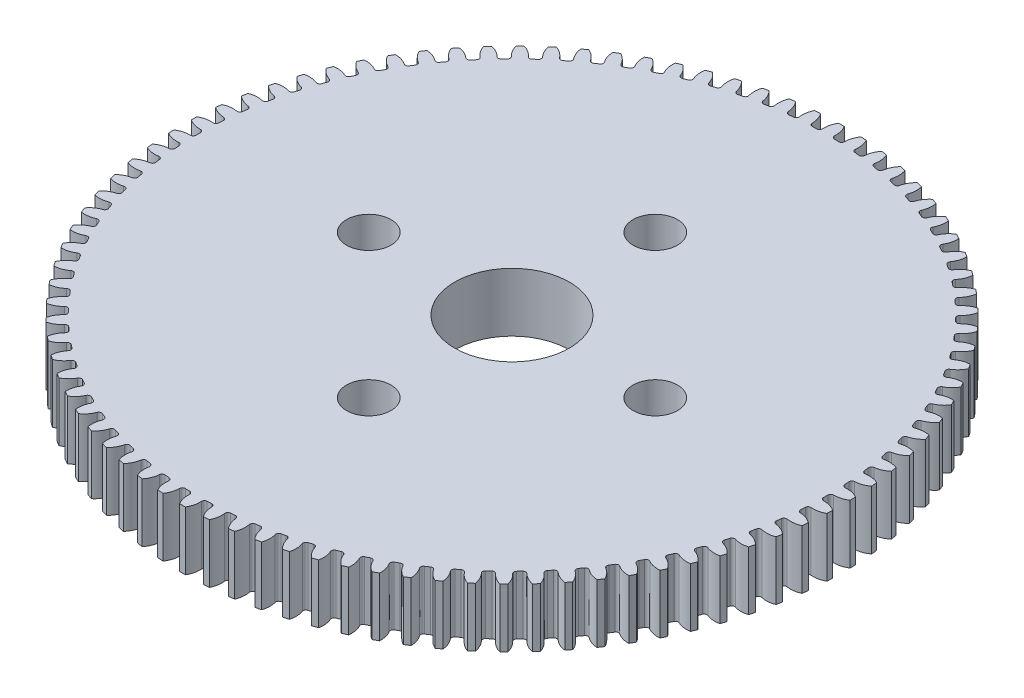
from build123d import *

# Parameters (mm, degrees)
SKETCH1_R           = 1.55
SKETCH1_R_2         = 4
BOSS_EXTRUDE1_DEPTH = 4.1


with BuildPart() as part:
    # Sketch1 → Boss-Extrude1 (new body)
    with BuildSketch(Plane(origin=(0, 0, 0), x_dir=(1, 0, 0), z_dir=(0, 1, 0))):
        with BuildLine():
            Line((0.1965, 23), (-0.1965, 23))
            ThreePointArc((-0.1965, 23), (-0.377010574, 22.569135791), (-0.41916526, 22.103892825))
            ThreePointArc((-0.41916526, 22.103892825), (-0.471074822, 21.956480692), (-0.613170946, 21.891414331))
            ThreePointArc((-0.613170946, 21.891414331), (-0.764298978, 21.886659112), (-0.915390576, 21.880860588))
            ThreePointArc((-0.915390576, 21.880860588), (-1.061679361, 21.935856327), (-1.123745425, 22.079288344))
            ThreePointArc((-1.123745425, 22.079288344), (-1.198251133, 22.540457438), (-1.40837756, 22.957680303))
            Line((-1.40837756, 22.957680303), (-1.800420232, 22.930266009))
            ThreePointArc((-1.800420232, 22.930266009), (-1.950435523, 22.487859582), (-1.960033814, 22.020809363))
            ThreePointArc((-1.960033814, 22.020809363), (-2.001533977, 21.87013529), (-2.138745162, 21.795315302))
            ThreePointArc((-2.138745162, 21.795315302), (-2.289173346, 21.780029509), (-2.439492408, 21.763705493))
            ThreePointArc((-2.439492408, 21.763705493), (-2.58926115, 21.808362675), (-2.661181336, 21.947115789))
            ThreePointArc((-2.661181336, 21.947115789), (-2.767675081, 22.401964243), (-3.006393647, 22.803513095))
            Line((-3.006393647, 22.803513095), (-3.395568998, 22.748818067))
            ThreePointArc((-3.395568998, 22.748818067), (-3.514358147, 22.297024782), (-3.49135328, 21.830442731))
            ThreePointArc((-3.49135328, 21.830442731), (-3.522241858, 21.677240787), (-3.653899626, 21.593031689))
            ThreePointArc((-3.653899626, 21.593031689), (-3.802895091, 21.567289791), (-3.951709278, 21.540519812))
            ThreePointArc((-3.951709278, 21.540519812), (-4.104228318, 21.574620872), (-4.185652238, 21.708019092))
            ThreePointArc((-4.185652238, 21.708019092), (-4.323615194, 22.15433093), (-4.589762885, 22.538249464))
            Line((-4.589762885, 22.538249464), (-4.974174892, 22.45654017))
            ThreePointArc((-4.974174892, 22.45654017), (-5.061159171, 21.997561118), (-5.005663224, 21.533720376))
            ThreePointArc((-5.005663224, 21.533720376), (-5.025789732, 21.378736946), (-5.151252658, 21.285548996))
            ThreePointArc((-5.151252658, 21.285548996), (-5.298089514, 21.249476405), (-5.444673817, 21.212390884))
            ThreePointArc((-5.444673817, 21.212390884), (-5.599200098, 21.235769685), (-5.689731063, 21.363163108))
            ThreePointArc((-5.689731063, 21.363163108), (-5.858491089, 21.798763944), (-6.150771261, 22.163181747))
            Line((-6.150771261, 22.163181747), (-6.528547107, 22.054856266))
            ThreePointArc((-6.528547107, 22.054856266), (-6.583302736, 21.590927548), (-6.49558608, 21.1320879))
            ThreePointArc((-6.49558608, 21.1320879), (-6.504852463, 20.976078048), (-6.623509305, 20.874365248))
            ThreePointArc((-6.623509305, 20.874365248), (-6.767472177, 20.828137707), (-6.911112453, 20.78091732))
            ThreePointArc((-6.911112453, 20.78091732), (-7.066893139, 20.793459963), (-7.166090091, 20.914227941))
            ThreePointArc((-7.166090091, 20.914227941), (-7.364825004, 21.33699557), (-7.681813697, 21.680137236))
            Line((-7.681813697, 21.680137236), (-8.051112896, 21.54572332))
            ThreePointArc((-8.051112896, 21.54572332), (-8.073373112, 21.079105149), (-7.953863094, 20.627502016))
            ThreePointArc((-7.953863094, 20.627502016), (-7.952224207, 20.471225806), (-8.06349688, 20.36148369))
            ThreePointArc((-8.06349688, 20.36148369), (-8.203884396, 20.305326415), (-8.343880844, 20.248201215))
            ThreePointArc((-8.343880844, 20.248201215), (-8.500156986, 20.249846594), (-8.607536648, 20.363400758))
            ThreePointArc((-8.607536648, 20.363400758), (-8.835278231, 20.7712755), (-9.175431108, 21.091469276))
            Line((-9.175431108, 21.091469276), (-9.534454473, 20.931621775))
            ThreePointArc((-9.534454473, 20.931621775), (-9.524110826, 20.464587469), (-9.373389686, 20.022421016))
            ThreePointArc((-9.373389686, 20.022421016), (-9.360853514, 19.86663981), (-9.46419991, 19.749403031))
            ThreePointArc((-9.46419991, 19.749403031), (-9.600328115, 19.683589614), (-9.735998686, 19.61683791))
            ThreePointArc((-9.735998686, 19.61683791), (-9.892008923, 19.607578007), (-10.007048151, 19.713365133))
            ThreePointArc((-10.007048151, 19.713365133), (-10.262686872, 20.104359862), (-10.624346742, 20.400045798))
            Line((-10.624346742, 20.400045798), (-10.971345146, 20.215543474))
            ThreePointArc((-10.971345146, 20.215543474), (-10.928448029, 19.750368376), (-10.747250066, 19.319792793))
            ThreePointArc((-10.747250066, 19.319792793), (-10.723877684, 19.165265541), (-10.818794308, 19.041105265))
            ThreePointArc((-10.818794308, 19.041105265), (-10.95, 18.965956343), (-11.080683721, 18.889903342))
            ThreePointArc((-11.080683721, 18.889903342), (-11.235667987, 18.869783272), (-11.357806322, 18.967287974))
            ThreePointArc((-11.357806322, 18.967287974), (-11.640096733, 19.339497805), (-12.021501626, 19.609235347))
            Line((-12.021501626, 19.609235347), (-12.354784528, 19.400977076))
            ThreePointArc((-12.354784528, 19.400977076), (-12.279542932, 18.939927473), (-12.068750923, 18.523040482))
            ThreePointArc((-12.068750923, 18.523040482), (-12.034656199, 18.370520026), (-12.120680629, 18.240041148))
            ThreePointArc((-12.120680629, 18.240041148), (-12.246324586, 18.155922839), (-12.371384779, 18.070939064))
            ThreePointArc((-12.371384779, 18.070939064), (-12.524588006, 18.040056849), (-12.653230402, 18.128804096))
            ThreePointArc((-12.653230402, 18.128804096), (-12.960797213, 18.480415658), (-13.360088963, 18.722890673))
            Line((-13.360088963, 18.722890673), (-13.678032642, 18.491891069))
            ThreePointArc((-13.678032642, 18.491891069), (-13.570813136, 18.037213148), (-13.33145404, 17.63604578))
            ThreePointArc((-13.33145404, 17.63604578), (-13.28680308, 17.486275183), (-13.363516211, 17.350113385))
            ThreePointArc((-13.363516211, 17.350113385), (-13.48298631, 17.257435504), (-13.601813694, 17.163934987))
            ThreePointArc((-13.601813694, 17.163934987), (-13.752489491, 17.122441083), (-13.887009216, 17.201998506))
            ThreePointArc((-13.887009216, 17.201998506), (-14.218353993, 17.531298784), (-14.63358729, 17.745329957))
            Line((-14.63358729, 17.745329957), (-14.934642756, 17.492714426))
            ThreePointArc((-14.934642756, 17.492714426), (-14.795967703, 17.046623333), (-14.529207652, 16.663130035))
            ThreePointArc((-14.529207652, 16.663130035), (-14.474217991, 16.516838965), (-14.541246086, 16.375657613))
            ThreePointArc((-14.541246086, 16.375657613), (-14.653960279, 16.274871678), (-14.76597594, 16.173309944))
            ThreePointArc((-14.76597594, 16.173309944), (-14.91339023, 16.121406505), (-15.053131917, 16.191386508))
            ThreePointArc((-15.053131917, 16.191386508), (-15.40664038, 16.496771184), (-15.83579225, 16.681315778))
            Line((-15.83579225, 16.681315778), (-16.118492791, 16.408315038))
            ThreePointArc((-16.118492791, 16.408315038), (-15.949037802, 15.972984083), (-15.656176425, 15.609033195))
            ThreePointArc((-15.656176425, 15.609033195), (-15.591115967, 15.466934369), (-15.648132472, 15.321421283))
            ThreePointArc((-15.648132472, 15.321421283), (-15.753541627, 15.213018313), (-15.858199835, 15.103890161))
            ThreePointArc((-15.858199835, 15.103890161), (-16.00163443, 15.041830055), (-16.145917272, 15.101891703))
            ThreePointArc((-16.145917272, 15.101891703), (-16.519867164, 15.381872974), (-16.960846822, 15.536031904))
            Line((-16.960846822, 15.536031904), (-17.22381515, 15.243975988))
            ThreePointArc((-17.22381515, 15.243975988), (-17.024405792, 14.82152606), (-16.706869881, 14.478890715))
            ThreePointArc((-16.706869881, 14.478890715), (-16.632055593, 14.341676422), (-16.678782729, 14.192540529))
            ThreePointArc((-16.678782729, 14.192540529), (-16.776373304, 14.077048652), (-16.873164175, 13.960885743))
            ThreePointArc((-16.873164175, 13.960885743), (-17.011920276, 13.888971321), (-17.160041341, 13.938822))
            ThreePointArc((-17.160041341, 13.938822), (-17.552610817, 14.192035824), (-18.003269853, 14.315058046))
            Line((-18.003269853, 14.315058046), (-18.245224813, 14.005369819))
            ThreePointArc((-18.245224813, 14.005369819), (-18.016832589, 13.597859051), (-17.676169145, 13.278208535))
            ThreePointArc((-17.676169145, 13.278208535), (-17.591965516, 13.14654727), (-17.628175634, 12.994515144))
            ThreePointArc((-17.628175634, 12.994515144), (-17.717472177, 12.872497025), (-17.805924155, 12.749865293))
            ThreePointArc((-17.805924155, 12.749865293), (-17.939325757, 12.668446915), (-18.090563413, 12.707843757))
            ThreePointArc((-18.090563413, 12.707843757), (-18.499839913, 12.933056502), (-18.957982763, 13.024342663))
            Line((-18.957982763, 13.024342663), (-19.177745574, 12.698530897))
            ThreePointArc((-19.177745574, 12.698530897), (-18.921483188, 12.307944641), (-18.559351891, 12.012836258))
            ThreePointArc((-18.559351891, 12.012836258), (-18.466169152, 11.887369461), (-18.491685838, 11.733181788))
            ThreePointArc((-18.491685838, 11.733181788), (-18.572253306, 11.605231887), (-18.651935462, 11.476728782))
            ThreePointArc((-18.651935462, 11.476728782), (-18.779332646, 11.386203109), (-18.932950079, 11.414954176))
            ThreePointArc((-18.932950079, 11.414954176), (-19.356939649, 11.61106863), (-19.820334287, 11.670173992))
            Line((-19.820334287, 11.670173992), (-20.016834287, 11.329826008))
            ThreePointArc((-20.016834287, 11.329826008), (-19.733950223, 10.958067161), (-19.352115339, 10.688938649))
            ThreePointArc((-19.352115339, 10.688938649), (-19.250407468, 10.570277583), (-19.265106408, 10.414685549))
            ThreePointArc((-19.265106408, 10.414685549), (-19.336552284, 10.281427225), (-19.407076414, 10.147678801))
            ThreePointArc((-19.407076414, 10.147678801), (-19.527848513, 10.048486866), (-19.683097316, 10.066452086))
            ThreePointArc((-19.683097316, 10.066452086), (-20.119734321, 10.232512798), (-20.586123135, 10.259149406))
            Line((-20.586123135, 10.259149406), (-20.758402995, 9.905923346))
            ThreePointArc((-20.758402995, 9.905923346), (-20.450275436, 9.554803079), (-20.050597227, 9.312965607))
            ThreePointArc((-20.050597227, 9.312965607), (-19.940859733, 9.201688375), (-19.944669316, 9.045450009))
            ThreePointArc((-19.944669316, 9.045450009), (-20.006645522, 8.907532483), (-20.067668042, 8.769190349))
            ThreePointArc((-20.067668042, 8.769190349), (-20.181226666, 8.661815405), (-20.337350481, 8.668907254))
            ThreePointArc((-20.337350481, 8.668907254), (-20.78450767, 8.804105192), (-21.251618459, 8.798143276))
            Line((-21.251618459, 8.798143276), (-21.398838851, 8.433760021))
            ThreePointArc((-21.398838851, 8.433760021), (-21.066968963, 8.104988958), (-20.651394621, 7.891620731))
            ThreePointArc((-20.651394621, 7.891620731), (-20.534162135, 7.788269466), (-20.5270638, 7.632145946))
            ThreePointArc((-20.5270638, 7.632145946), (-20.579268395, 7.490241139), (-20.630492007, 7.347979283))
            ThreePointArc((-20.630492007, 7.347979283), (-20.736283911, 7.23294445), (-20.892522118, 7.229128377))
            ThreePointArc((-20.892522118, 7.229128377), (-21.348020986, 7.332804871), (-21.813578035, 7.294273476))
            Line((-21.813578035, 7.294273476), (-21.935021714, 6.920508265))
            ThreePointArc((-21.935021714, 6.920508265), (-21.581026335, 6.615688145), (-21.151580496, 6.431828673))
            ThreePointArc((-21.151580496, 6.431828673), (-21.027424162, 6.336906891), (-21.009452493, 6.181658835))
            ThreePointArc((-21.009452493, 6.181658835), (-21.051631141, 6.036458092), (-21.092806289, 5.890969601))
            ThreePointArc((-21.092806289, 5.890969601), (-21.190316065, 5.768835316), (-21.345907488, 5.754129913))
            ThreePointArc((-21.345907488, 5.754129913), (-21.807528891, 5.825779861), (-22.269264052, 5.754866709))
            Line((-22.269264052, 5.754866709), (-22.364339357, 5.373540489))
            ThreePointArc((-22.364339357, 5.373540489), (-21.989943116, 5.094156364), (-21.548717997, 4.940701392))
            ThreePointArc((-21.548717997, 4.940701392), (-21.418242693, 4.854671543), (-21.389485245, 4.701055303))
            ThreePointArc((-21.389485245, 4.701055303), (-21.421432456, 4.553266029), (-21.45235854, 4.405259707))
            ThreePointArc((-21.45235854, 4.405259707), (-21.54111113, 4.276620997), (-21.695297743, 4.251097906))
            ThreePointArc((-21.695297743, 4.251097906), (-22.160792706, 4.290372238), (-22.616456452, 4.18742281))
            Line((-22.616456452, 4.18742281), (-22.684700186, 3.800393363))
            ThreePointArc((-22.684700186, 3.800393363), (-22.291727104, 3.547806366), (-21.84087231, 3.425503511))
            ThreePointArc((-21.84087231, 3.425503511), (-21.704713698, 3.348784723), (-21.665310575, 3.197548703))
            ThreePointArc((-21.665310575, 3.197548703), (-21.686870705, 3.047890911), (-21.707397056, 2.89808783))
            ThreePointArc((-21.707397056, 2.89808783), (-21.786960066, 2.763571411), (-21.938990687, 2.727354978))
            ThreePointArc((-21.938990687, 2.727354978), (-22.406091367, 2.734062352), (-22.85346375, 2.599578208))
            Line((-22.85346375, 2.599578208), (-22.894543437, 2.208731103))
            ThreePointArc((-22.894543437, 2.208731103), (-22.484908039, 1.984171811), (-22.026620088, 1.893616921))
            ThreePointArc((-22.026620088, 1.893616921), (-21.88544152, 1.82658296), (-21.835584689, 1.678463967))
            ThreePointArc((-21.835584689, 1.678463967), (-21.846652701, 1.527666775), (-21.856679315, 1.376796761))
            ThreePointArc((-21.856679315, 1.376796761), (-21.926665123, 1.237057982), (-22.075799075, 1.19032465))
            ThreePointArc((-22.075799075, 1.19032465), (-22.542229804, 1.164432389), (-22.97913127, 0.999068722))
            Line((-22.97913127, 0.999068722), (-22.992846773, 0.606308127))
            ThreePointArc((-22.992846773, 0.606308127), (-22.568544762, 0.410870571), (-22.105056388, 0.352504819))
            ThreePointArc((-22.105056388, 0.352504819), (-21.959545671, 0.295482269), (-21.89947803, 0.151201923))
            ThreePointArc((-21.89947803, 0.151201923), (-21.9, 0), (-21.89947803, -0.151201923))
            ThreePointArc((-21.89947803, -0.151201923), (-21.959545671, -0.295482269), (-22.105056388, -0.352504819))
            ThreePointArc((-22.105056388, -0.352504819), (-22.568544762, -0.410870571), (-22.992846773, -0.606308127))
            Line((-22.992846773, -0.606308127), (-22.97913127, -0.999068722))
            ThreePointArc((-22.97913127, -0.999068722), (-22.542229804, -1.164432389), (-22.075799075, -1.19032465))
            ThreePointArc((-22.075799075, -1.19032465), (-21.926665123, -1.237057982), (-21.856679315, -1.376796761))
            ThreePointArc((-21.856679315, -1.376796761), (-21.846652701, -1.527666775), (-21.835584689, -1.678463967))
            ThreePointArc((-21.835584689, -1.678463967), (-21.88544152, -1.82658296), (-22.026620088, -1.893616921))
            ThreePointArc((-22.026620088, -1.893616921), (-22.484908039, -1.984171811), (-22.894543437, -2.208731103))
            Line((-22.894543437, -2.208731103), (-22.85346375, -2.599578208))
            ThreePointArc((-22.85346375, -2.599578208), (-22.406091367, -2.734062352), (-21.938990687, -2.727354978))
            ThreePointArc((-21.938990687, -2.727354978), (-21.786960066, -2.763571411), (-21.707397056, -2.89808783))
            ThreePointArc((-21.707397056, -2.89808783), (-21.686870705, -3.047890911), (-21.665310575, -3.197548703))
            ThreePointArc((-21.665310575, -3.197548703), (-21.704713698, -3.348784723), (-21.84087231, -3.425503511))
            ThreePointArc((-21.84087231, -3.425503511), (-22.291727104, -3.547806366), (-22.684700186, -3.800393363))
            Line((-22.684700186, -3.800393363), (-22.616456452, -4.18742281))
            ThreePointArc((-22.616456452, -4.18742281), (-22.160792706, -4.290372238), (-21.695297743, -4.251097906))
            ThreePointArc((-21.695297743, -4.251097906), (-21.54111113, -4.276620997), (-21.45235854, -4.405259707))
            ThreePointArc((-21.45235854, -4.405259707), (-21.421432456, -4.553266029), (-21.389485245, -4.701055303))
            ThreePointArc((-21.389485245, -4.701055303), (-21.418242693, -4.854671543), (-21.548717997, -4.940701392))
            ThreePointArc((-21.548717997, -4.940701392), (-21.989943116, -5.094156364), (-22.364339357, -5.373540489))
            Line((-22.364339357, -5.373540489), (-22.269264052, -5.754866709))
            ThreePointArc((-22.269264052, -5.754866709), (-21.807528891, -5.825779861), (-21.345907488, -5.754129913))
            ThreePointArc((-21.345907488, -5.754129913), (-21.190316065, -5.768835316), (-21.092806289, -5.890969601))
            ThreePointArc((-21.092806289, -5.890969601), (-21.051631141, -6.036458092), (-21.009452493, -6.181658835))
            ThreePointArc((-21.009452493, -6.181658835), (-21.027424162, -6.336906891), (-21.151580496, -6.431828673))
            ThreePointArc((-21.151580496, -6.431828673), (-21.581026335, -6.615688145), (-21.935021714, -6.920508265))
            Line((-21.935021714, -6.920508265), (-21.813578035, -7.294273476))
            ThreePointArc((-21.813578035, -7.294273476), (-21.348020986, -7.332804871), (-20.892522118, -7.229128377))
            ThreePointArc((-20.892522118, -7.229128377), (-20.736283911, -7.23294445), (-20.630492007, -7.347979283))
            ThreePointArc((-20.630492007, -7.347979283), (-20.579268395, -7.490241139), (-20.5270638, -7.632145946))
            ThreePointArc((-20.5270638, -7.632145946), (-20.534162135, -7.788269466), (-20.651394621, -7.891620731))
            ThreePointArc((-20.651394621, -7.891620731), (-21.066968963, -8.104988958), (-21.398838851, -8.433760021))
            Line((-21.398838851, -8.433760021), (-21.251618459, -8.798143276))
            ThreePointArc((-21.251618459, -8.798143276), (-20.78450767, -8.804105192), (-20.337350481, -8.668907254))
            ThreePointArc((-20.337350481, -8.668907254), (-20.181226666, -8.661815405), (-20.067668042, -8.769190349))
            ThreePointArc((-20.067668042, -8.769190349), (-20.006645522, -8.907532483), (-19.944669316, -9.045450009))
            ThreePointArc((-19.944669316, -9.045450009), (-19.940859733, -9.201688375), (-20.050597227, -9.312965607))
            ThreePointArc((-20.050597227, -9.312965607), (-20.450275436, -9.554803079), (-20.758402995, -9.905923346))
            Line((-20.758402995, -9.905923346), (-20.586123135, -10.259149406))
            ThreePointArc((-20.586123135, -10.259149406), (-20.119734321, -10.232512798), (-19.683097316, -10.066452086))
            ThreePointArc((-19.683097316, -10.066452086), (-19.527848513, -10.048486866), (-19.407076414, -10.147678801))
            ThreePointArc((-19.407076414, -10.147678801), (-19.336552284, -10.281427225), (-19.265106408, -10.414685549))
            ThreePointArc((-19.265106408, -10.414685549), (-19.250407468, -10.570277583), (-19.352115339, -10.688938649))
            ThreePointArc((-19.352115339, -10.688938649), (-19.733950223, -10.958067161), (-20.016834287, -11.329826008))
            Line((-20.016834287, -11.329826008), (-19.820334287, -11.670173992))
            ThreePointArc((-19.820334287, -11.670173992), (-19.356939649, -11.61106863), (-18.932950079, -11.414954176))
            ThreePointArc((-18.932950079, -11.414954176), (-18.779332646, -11.386203109), (-18.651935462, -11.476728782))
            ThreePointArc((-18.651935462, -11.476728782), (-18.572253306, -11.605231887), (-18.491685838, -11.733181788))
            ThreePointArc((-18.491685838, -11.733181788), (-18.466169152, -11.887369461), (-18.559351891, -12.012836258))
            ThreePointArc((-18.559351891, -12.012836258), (-18.921483188, -12.307944641), (-19.177745574, -12.698530897))
            Line((-19.177745574, -12.698530897), (-18.957982763, -13.024342663))
            ThreePointArc((-18.957982763, -13.024342663), (-18.499839913, -12.933056502), (-18.090563413, -12.707843757))
            ThreePointArc((-18.090563413, -12.707843757), (-17.939325757, -12.668446915), (-17.805924155, -12.749865293))
            ThreePointArc((-17.805924155, -12.749865293), (-17.717472177, -12.872497025), (-17.628175634, -12.994515144))
            ThreePointArc((-17.628175634, -12.994515144), (-17.591965516, -13.14654727), (-17.676169145, -13.278208535))
            ThreePointArc((-17.676169145, -13.278208535), (-18.016832589, -13.597859051), (-18.245224813, -14.005369819))
            Line((-18.245224813, -14.005369819), (-18.003269853, -14.315058046))
            ThreePointArc((-18.003269853, -14.315058046), (-17.552610817, -14.192035824), (-17.160041341, -13.938822))
            ThreePointArc((-17.160041341, -13.938822), (-17.011920276, -13.888971321), (-16.873164175, -13.960885743))
            ThreePointArc((-16.873164175, -13.960885743), (-16.776373304, -14.077048652), (-16.678782729, -14.192540529))
            ThreePointArc((-16.678782729, -14.192540529), (-16.632055593, -14.341676422), (-16.706869881, -14.478890715))
            ThreePointArc((-16.706869881, -14.478890715), (-17.024405792, -14.82152606), (-17.22381515, -15.243975988))
            Line((-17.22381515, -15.243975988), (-16.960846822, -15.536031904))
            ThreePointArc((-16.960846822, -15.536031904), (-16.519867164, -15.381872974), (-16.145917272, -15.101891703))
            ThreePointArc((-16.145917272, -15.101891703), (-16.00163443, -15.041830055), (-15.858199835, -15.103890161))
            ThreePointArc((-15.858199835, -15.103890161), (-15.753541627, -15.213018313), (-15.648132472, -15.321421283))
            ThreePointArc((-15.648132472, -15.321421283), (-15.591115967, -15.466934369), (-15.656176425, -15.609033195))
            ThreePointArc((-15.656176425, -15.609033195), (-15.949037802, -15.972984083), (-16.118492791, -16.408315038))
            Line((-16.118492791, -16.408315038), (-15.83579225, -16.681315778))
            ThreePointArc((-15.83579225, -16.681315778), (-15.40664038, -16.496771184), (-15.053131917, -16.191386508))
            ThreePointArc((-15.053131917, -16.191386508), (-14.91339023, -16.121406505), (-14.76597594, -16.173309944))
            ThreePointArc((-14.76597594, -16.173309944), (-14.653960279, -16.274871678), (-14.541246086, -16.375657613))
            ThreePointArc((-14.541246086, -16.375657613), (-14.474217991, -16.516838965), (-14.529207652, -16.663130035))
            ThreePointArc((-14.529207652, -16.663130035), (-14.795967703, -17.046623333), (-14.934642756, -17.492714426))
            Line((-14.934642756, -17.492714426), (-14.63358729, -17.745329957))
            ThreePointArc((-14.63358729, -17.745329957), (-14.218353993, -17.531298784), (-13.887009216, -17.201998506))
            ThreePointArc((-13.887009216, -17.201998506), (-13.752489491, -17.122441083), (-13.601813694, -17.163934987))
            ThreePointArc((-13.601813694, -17.163934987), (-13.48298631, -17.257435504), (-13.363516211, -17.350113385))
            ThreePointArc((-13.363516211, -17.350113385), (-13.28680308, -17.486275183), (-13.33145404, -17.63604578))
            ThreePointArc((-13.33145404, -17.63604578), (-13.570813136, -18.037213148), (-13.678032642, -18.491891069))
            Line((-13.678032642, -18.491891069), (-13.360088963, -18.722890673))
            ThreePointArc((-13.360088963, -18.722890673), (-12.960797213, -18.480415658), (-12.653230402, -18.128804096))
            ThreePointArc((-12.653230402, -18.128804096), (-12.524588006, -18.040056849), (-12.371384779, -18.070939064))
            ThreePointArc((-12.371384779, -18.070939064), (-12.246324586, -18.155922839), (-12.120680629, -18.240041148))
            ThreePointArc((-12.120680629, -18.240041148), (-12.034656199, -18.370520026), (-12.068750923, -18.523040482))
            ThreePointArc((-12.068750923, -18.523040482), (-12.279542932, -18.939927473), (-12.354784528, -19.400977076))
            Line((-12.354784528, -19.400977076), (-12.021501626, -19.609235347))
            ThreePointArc((-12.021501626, -19.609235347), (-11.640096733, -19.339497805), (-11.357806322, -18.967287974))
            ThreePointArc((-11.357806322, -18.967287974), (-11.235667987, -18.869783272), (-11.080683721, -18.889903342))
            ThreePointArc((-11.080683721, -18.889903342), (-10.95, -18.965956343), (-10.818794308, -19.041105265))
            ThreePointArc((-10.818794308, -19.041105265), (-10.723877684, -19.165265541), (-10.747250066, -19.319792793))
            ThreePointArc((-10.747250066, -19.319792793), (-10.928448029, -19.750368376), (-10.971345146, -20.215543474))
            Line((-10.971345146, -20.215543474), (-10.624346742, -20.400045798))
            ThreePointArc((-10.624346742, -20.400045798), (-10.262686872, -20.104359862), (-10.007048151, -19.713365133))
            ThreePointArc((-10.007048151, -19.713365133), (-9.892008923, -19.607578007), (-9.735998686, -19.61683791))
            ThreePointArc((-9.735998686, -19.61683791), (-9.600328115, -19.683589614), (-9.46419991, -19.749403031))
            ThreePointArc((-9.46419991, -19.749403031), (-9.360853514, -19.86663981), (-9.373389686, -20.022421016))
            ThreePointArc((-9.373389686, -20.022421016), (-9.524110826, -20.464587469), (-9.534454473, -20.931621775))
            Line((-9.534454473, -20.931621775), (-9.175431108, -21.091469276))
            ThreePointArc((-9.175431108, -21.091469276), (-8.835278231, -20.7712755), (-8.607536648, -20.363400758))
            ThreePointArc((-8.607536648, -20.363400758), (-8.500156986, -20.249846594), (-8.343880844, -20.248201215))
            ThreePointArc((-8.343880844, -20.248201215), (-8.203884396, -20.305326415), (-8.06349688, -20.36148369))
            ThreePointArc((-8.06349688, -20.36148369), (-7.952224207, -20.471225806), (-7.953863094, -20.627502016))
            ThreePointArc((-7.953863094, -20.627502016), (-8.073373112, -21.079105149), (-8.051112896, -21.54572332))
            Line((-8.051112896, -21.54572332), (-7.681813697, -21.680137236))
            ThreePointArc((-7.681813697, -21.680137236), (-7.364825004, -21.33699557), (-7.166090091, -20.914227941))
            ThreePointArc((-7.166090091, -20.914227941), (-7.066893139, -20.793459963), (-6.911112453, -20.78091732))
            ThreePointArc((-6.911112453, -20.78091732), (-6.767472177, -20.828137707), (-6.623509305, -20.874365248))
            ThreePointArc((-6.623509305, -20.874365248), (-6.504852463, -20.976078048), (-6.49558608, -21.1320879))
            ThreePointArc((-6.49558608, -21.1320879), (-6.583302736, -21.590927548), (-6.528547107, -22.054856266))
            Line((-6.528547107, -22.054856266), (-6.150771261, -22.163181747))
            ThreePointArc((-6.150771261, -22.163181747), (-5.858491089, -21.798763944), (-5.689731063, -21.363163108))
            ThreePointArc((-5.689731063, -21.363163108), (-5.599200098, -21.235769685), (-5.444673817, -21.212390884))
            ThreePointArc((-5.444673817, -21.212390884), (-5.298089514, -21.249476405), (-5.151252658, -21.285548996))
            ThreePointArc((-5.151252658, -21.285548996), (-5.025789732, -21.378736946), (-5.005663224, -21.533720376))
            ThreePointArc((-5.005663224, -21.533720376), (-5.061159171, -21.997561118), (-4.974174892, -22.45654017))
            Line((-4.974174892, -22.45654017), (-4.589762885, -22.538249464))
            ThreePointArc((-4.589762885, -22.538249464), (-4.323615194, -22.15433093), (-4.185652238, -21.708019092))
            ThreePointArc((-4.185652238, -21.708019092), (-4.104228318, -21.574620872), (-3.951709278, -21.540519812))
            ThreePointArc((-3.951709278, -21.540519812), (-3.802895091, -21.567289791), (-3.653899626, -21.593031689))
            ThreePointArc((-3.653899626, -21.593031689), (-3.522241858, -21.677240787), (-3.49135328, -21.830442731))
            ThreePointArc((-3.49135328, -21.830442731), (-3.514358147, -22.297024782), (-3.395568998, -22.748818067))
            Line((-3.395568998, -22.748818067), (-3.006393647, -22.803513095))
            ThreePointArc((-3.006393647, -22.803513095), (-2.767675081, -22.401964243), (-2.661181336, -21.947115789))
            ThreePointArc((-2.661181336, -21.947115789), (-2.58926115, -21.808362675), (-2.439492408, -21.763705493))
            ThreePointArc((-2.439492408, -21.763705493), (-2.289173346, -21.780029509), (-2.138745162, -21.795315302))
            ThreePointArc((-2.138745162, -21.795315302), (-2.001533977, -21.87013529), (-1.960033814, -22.020809363))
            ThreePointArc((-1.960033814, -22.020809363), (-1.950435523, -22.487859582), (-1.800420232, -22.930266009))
            Line((-1.800420232, -22.930266009), (-1.40837756, -22.957680303))
            ThreePointArc((-1.40837756, -22.957680303), (-1.198251133, -22.540457438), (-1.123745425, -22.079288344))
            ThreePointArc((-1.123745425, -22.079288344), (-1.061679361, -21.935856327), (-0.915390576, -21.880860588))
            ThreePointArc((-0.915390576, -21.880860588), (-0.764298978, -21.886659112), (-0.613170946, -21.891414331))
            ThreePointArc((-0.613170946, -21.891414331), (-0.471074822, -21.956480692), (-0.41916526, -22.103892825))
            ThreePointArc((-0.41916526, -22.103892825), (-0.377010574, -22.569135791), (-0.1965, -23))
            Line((-0.1965, -23), (0.1965, -23))
            ThreePointArc((0.1965, -23), (0.377010574, -22.569135791), (0.41916526, -22.103892825))
            ThreePointArc((0.41916526, -22.103892825), (0.471074822, -21.956480692), (0.613170946, -21.891414331))
            ThreePointArc((0.613170946, -21.891414331), (0.764298978, -21.886659112), (0.915390576, -21.880860588))
            ThreePointArc((0.915390576, -21.880860588), (1.061679361, -21.935856327), (1.123745425, -22.079288344))
            ThreePointArc((1.123745425, -22.079288344), (1.198251133, -22.540457438), (1.40837756, -22.957680303))
            Line((1.40837756, -22.957680303), (1.800420232, -22.930266009))
            ThreePointArc((1.800420232, -22.930266009), (1.950435523, -22.487859582), (1.960033814, -22.020809363))
            ThreePointArc((1.960033814, -22.020809363), (2.001533977, -21.87013529), (2.138745162, -21.795315302))
            ThreePointArc((2.138745162, -21.795315302), (2.289173346, -21.780029509), (2.439492408, -21.763705493))
            ThreePointArc((2.439492408, -21.763705493), (2.58926115, -21.808362675), (2.661181336, -21.947115789))
            ThreePointArc((2.661181336, -21.947115789), (2.767675081, -22.401964243), (3.006393647, -22.803513095))
            Line((3.006393647, -22.803513095), (3.395568998, -22.748818067))
            ThreePointArc((3.395568998, -22.748818067), (3.514358147, -22.297024782), (3.49135328, -21.830442731))
            ThreePointArc((3.49135328, -21.830442731), (3.522241858, -21.677240787), (3.653899626, -21.593031689))
            ThreePointArc((3.653899626, -21.593031689), (3.802895091, -21.567289791), (3.951709278, -21.540519812))
            ThreePointArc((3.951709278, -21.540519812), (4.104228318, -21.574620872), (4.185652238, -21.708019092))
            ThreePointArc((4.185652238, -21.708019092), (4.323615194, -22.15433093), (4.589762885, -22.538249464))
            Line((4.589762885, -22.538249464), (4.974174892, -22.45654017))
            ThreePointArc((4.974174892, -22.45654017), (5.061159171, -21.997561118), (5.005663224, -21.533720376))
            ThreePointArc((5.005663224, -21.533720376), (5.025789732, -21.378736946), (5.151252658, -21.285548996))
            ThreePointArc((5.151252658, -21.285548996), (5.298089514, -21.249476405), (5.444673817, -21.212390884))
            ThreePointArc((5.444673817, -21.212390884), (5.599200098, -21.235769685), (5.689731063, -21.363163108))
            ThreePointArc((5.689731063, -21.363163108), (5.858491089, -21.798763944), (6.150771261, -22.163181747))
            Line((6.150771261, -22.163181747), (6.528547107, -22.054856266))
            ThreePointArc((6.528547107, -22.054856266), (6.583302736, -21.590927548), (6.49558608, -21.1320879))
            ThreePointArc((6.49558608, -21.1320879), (6.504852463, -20.976078048), (6.623509305, -20.874365248))
            ThreePointArc((6.623509305, -20.874365248), (6.767472177, -20.828137707), (6.911112453, -20.78091732))
            ThreePointArc((6.911112453, -20.78091732), (7.066893139, -20.793459963), (7.166090091, -20.914227941))
            ThreePointArc((7.166090091, -20.914227941), (7.364825004, -21.33699557), (7.681813697, -21.680137236))
            Line((7.681813697, -21.680137236), (8.051112896, -21.54572332))
            ThreePointArc((8.051112896, -21.54572332), (8.073373112, -21.079105149), (7.953863094, -20.627502016))
            ThreePointArc((7.953863094, -20.627502016), (7.952224207, -20.471225806), (8.06349688, -20.36148369))
            ThreePointArc((8.06349688, -20.36148369), (8.203884396, -20.305326415), (8.343880844, -20.248201215))
            ThreePointArc((8.343880844, -20.248201215), (8.500156986, -20.249846594), (8.607536648, -20.363400758))
            ThreePointArc((8.607536648, -20.363400758), (8.835278231, -20.7712755), (9.175431108, -21.091469276))
            Line((9.175431108, -21.091469276), (9.534454473, -20.931621775))
            ThreePointArc((9.534454473, -20.931621775), (9.524110826, -20.464587469), (9.373389686, -20.022421016))
            ThreePointArc((9.373389686, -20.022421016), (9.360853514, -19.86663981), (9.46419991, -19.749403031))
            ThreePointArc((9.46419991, -19.749403031), (9.600328115, -19.683589614), (9.735998686, -19.61683791))
            ThreePointArc((9.735998686, -19.61683791), (9.892008923, -19.607578007), (10.007048151, -19.713365133))
            ThreePointArc((10.007048151, -19.713365133), (10.262686872, -20.104359862), (10.624346742, -20.400045798))
            Line((10.624346742, -20.400045798), (10.971345146, -20.215543474))
            ThreePointArc((10.971345146, -20.215543474), (10.928448029, -19.750368376), (10.747250066, -19.319792793))
            ThreePointArc((10.747250066, -19.319792793), (10.723877684, -19.165265541), (10.818794308, -19.041105265))
            ThreePointArc((10.818794308, -19.041105265), (10.95, -18.965956343), (11.080683721, -18.889903342))
            ThreePointArc((11.080683721, -18.889903342), (11.235667987, -18.869783272), (11.357806322, -18.967287974))
            ThreePointArc((11.357806322, -18.967287974), (11.640096733, -19.339497805), (12.021501626, -19.609235347))
            Line((12.021501626, -19.609235347), (12.354784528, -19.400977076))
            ThreePointArc((12.354784528, -19.400977076), (12.279542932, -18.939927473), (12.068750923, -18.523040482))
            ThreePointArc((12.068750923, -18.523040482), (12.034656199, -18.370520026), (12.120680629, -18.240041148))
            ThreePointArc((12.120680629, -18.240041148), (12.246324586, -18.155922839), (12.371384779, -18.070939064))
            ThreePointArc((12.371384779, -18.070939064), (12.524588006, -18.040056849), (12.653230402, -18.128804096))
            ThreePointArc((12.653230402, -18.128804096), (12.960797213, -18.480415658), (13.360088963, -18.722890673))
            Line((13.360088963, -18.722890673), (13.678032642, -18.491891069))
            ThreePointArc((13.678032642, -18.491891069), (13.570813136, -18.037213148), (13.33145404, -17.63604578))
            ThreePointArc((13.33145404, -17.63604578), (13.28680308, -17.486275183), (13.363516211, -17.350113385))
            ThreePointArc((13.363516211, -17.350113385), (13.48298631, -17.257435504), (13.601813694, -17.163934987))
            ThreePointArc((13.601813694, -17.163934987), (13.752489491, -17.122441083), (13.887009216, -17.201998506))
            ThreePointArc((13.887009216, -17.201998506), (14.218353993, -17.531298784), (14.63358729, -17.745329957))
            Line((14.63358729, -17.745329957), (14.934642756, -17.492714426))
            ThreePointArc((14.934642756, -17.492714426), (14.795967703, -17.046623333), (14.529207652, -16.663130035))
            ThreePointArc((14.529207652, -16.663130035), (14.474217991, -16.516838965), (14.541246086, -16.375657613))
            ThreePointArc((14.541246086, -16.375657613), (14.653960279, -16.274871678), (14.76597594, -16.173309944))
            ThreePointArc((14.76597594, -16.173309944), (14.91339023, -16.121406505), (15.053131917, -16.191386508))
            ThreePointArc((15.053131917, -16.191386508), (15.40664038, -16.496771184), (15.83579225, -16.681315778))
            Line((15.83579225, -16.681315778), (16.118492791, -16.408315038))
            ThreePointArc((16.118492791, -16.408315038), (15.949037802, -15.972984083), (15.656176425, -15.609033195))
            ThreePointArc((15.656176425, -15.609033195), (15.591115967, -15.466934369), (15.648132472, -15.321421283))
            ThreePointArc((15.648132472, -15.321421283), (15.753541627, -15.213018313), (15.858199835, -15.103890161))
            ThreePointArc((15.858199835, -15.103890161), (16.00163443, -15.041830055), (16.145917272, -15.101891703))
            ThreePointArc((16.145917272, -15.101891703), (16.519867164, -15.381872974), (16.960846822, -15.536031904))
            Line((16.960846822, -15.536031904), (17.22381515, -15.243975988))
            ThreePointArc((17.22381515, -15.243975988), (17.024405792, -14.82152606), (16.706869881, -14.478890715))
            ThreePointArc((16.706869881, -14.478890715), (16.632055593, -14.341676422), (16.678782729, -14.192540529))
            ThreePointArc((16.678782729, -14.192540529), (16.776373304, -14.077048652), (16.873164175, -13.960885743))
            ThreePointArc((16.873164175, -13.960885743), (17.011920276, -13.888971321), (17.160041341, -13.938822))
            ThreePointArc((17.160041341, -13.938822), (17.552610817, -14.192035824), (18.003269853, -14.315058046))
            Line((18.003269853, -14.315058046), (18.245224813, -14.005369819))
            ThreePointArc((18.245224813, -14.005369819), (18.016832589, -13.597859051), (17.676169145, -13.278208535))
            ThreePointArc((17.676169145, -13.278208535), (17.591965516, -13.14654727), (17.628175634, -12.994515144))
            ThreePointArc((17.628175634, -12.994515144), (17.717472177, -12.872497025), (17.805924155, -12.749865293))
            ThreePointArc((17.805924155, -12.749865293), (17.939325757, -12.668446915), (18.090563413, -12.707843757))
            ThreePointArc((18.090563413, -12.707843757), (18.499839913, -12.933056502), (18.957982763, -13.024342663))
            Line((18.957982763, -13.024342663), (19.177745574, -12.698530897))
            ThreePointArc((19.177745574, -12.698530897), (18.921483188, -12.307944641), (18.559351891, -12.012836258))
            ThreePointArc((18.559351891, -12.012836258), (18.466169152, -11.887369461), (18.491685838, -11.733181788))
            ThreePointArc((18.491685838, -11.733181788), (18.572253306, -11.605231887), (18.651935462, -11.476728782))
            ThreePointArc((18.651935462, -11.476728782), (18.779332646, -11.386203109), (18.932950079, -11.414954176))
            ThreePointArc((18.932950079, -11.414954176), (19.356939649, -11.61106863), (19.820334287, -11.670173992))
            Line((19.820334287, -11.670173992), (20.016834287, -11.329826008))
            ThreePointArc((20.016834287, -11.329826008), (19.733950223, -10.958067161), (19.352115339, -10.688938649))
            ThreePointArc((19.352115339, -10.688938649), (19.250407468, -10.570277583), (19.265106408, -10.414685549))
            ThreePointArc((19.265106408, -10.414685549), (19.336552284, -10.281427225), (19.407076414, -10.147678801))
            ThreePointArc((19.407076414, -10.147678801), (19.527848513, -10.048486866), (19.683097316, -10.066452086))
            ThreePointArc((19.683097316, -10.066452086), (20.119734321, -10.232512798), (20.586123135, -10.259149406))
            Line((20.586123135, -10.259149406), (20.758402995, -9.905923346))
            ThreePointArc((20.758402995, -9.905923346), (20.450275436, -9.554803079), (20.050597227, -9.312965607))
            ThreePointArc((20.050597227, -9.312965607), (19.940859733, -9.201688375), (19.944669316, -9.045450009))
            ThreePointArc((19.944669316, -9.045450009), (20.006645522, -8.907532483), (20.067668042, -8.769190349))
            ThreePointArc((20.067668042, -8.769190349), (20.181226666, -8.661815405), (20.337350481, -8.668907254))
            ThreePointArc((20.337350481, -8.668907254), (20.78450767, -8.804105192), (21.251618459, -8.798143276))
            Line((21.251618459, -8.798143276), (21.398838851, -8.433760021))
            ThreePointArc((21.398838851, -8.433760021), (21.066968963, -8.104988958), (20.651394621, -7.891620731))
            ThreePointArc((20.651394621, -7.891620731), (20.534162135, -7.788269466), (20.5270638, -7.632145946))
            ThreePointArc((20.5270638, -7.632145946), (20.579268395, -7.490241139), (20.630492007, -7.347979283))
            ThreePointArc((20.630492007, -7.347979283), (20.736283911, -7.23294445), (20.892522118, -7.229128377))
            ThreePointArc((20.892522118, -7.229128377), (21.348020986, -7.332804871), (21.813578035, -7.294273476))
            Line((21.813578035, -7.294273476), (21.935021714, -6.920508265))
            ThreePointArc((21.935021714, -6.920508265), (21.581026335, -6.615688145), (21.151580496, -6.431828673))
            ThreePointArc((21.151580496, -6.431828673), (21.027424162, -6.336906891), (21.009452493, -6.181658835))
            ThreePointArc((21.009452493, -6.181658835), (21.051631141, -6.036458092), (21.092806289, -5.890969601))
            ThreePointArc((21.092806289, -5.890969601), (21.190316065, -5.768835316), (21.345907488, -5.754129913))
            ThreePointArc((21.345907488, -5.754129913), (21.807528891, -5.825779861), (22.269264052, -5.754866709))
            Line((22.269264052, -5.754866709), (22.364339357, -5.373540489))
            ThreePointArc((22.364339357, -5.373540489), (21.989943116, -5.094156364), (21.548717997, -4.940701392))
            ThreePointArc((21.548717997, -4.940701392), (21.418242693, -4.854671543), (21.389485245, -4.701055303))
            ThreePointArc((21.389485245, -4.701055303), (21.421432456, -4.553266029), (21.45235854, -4.405259707))
            ThreePointArc((21.45235854, -4.405259707), (21.54111113, -4.276620997), (21.695297743, -4.251097906))
            ThreePointArc((21.695297743, -4.251097906), (22.160792706, -4.290372238), (22.616456452, -4.18742281))
            Line((22.616456452, -4.18742281), (22.684700186, -3.800393363))
            ThreePointArc((22.684700186, -3.800393363), (22.291727104, -3.547806366), (21.84087231, -3.425503511))
            ThreePointArc((21.84087231, -3.425503511), (21.704713698, -3.348784723), (21.665310575, -3.197548703))
            ThreePointArc((21.665310575, -3.197548703), (21.686870705, -3.047890911), (21.707397056, -2.89808783))
            ThreePointArc((21.707397056, -2.89808783), (21.786960066, -2.763571411), (21.938990687, -2.727354978))
            ThreePointArc((21.938990687, -2.727354978), (22.406091367, -2.734062352), (22.85346375, -2.599578208))
            Line((22.85346375, -2.599578208), (22.894543437, -2.208731103))
            ThreePointArc((22.894543437, -2.208731103), (22.484908039, -1.984171811), (22.026620088, -1.893616921))
            ThreePointArc((22.026620088, -1.893616921), (21.88544152, -1.82658296), (21.835584689, -1.678463967))
            ThreePointArc((21.835584689, -1.678463967), (21.846652701, -1.527666775), (21.856679315, -1.376796761))
            ThreePointArc((21.856679315, -1.376796761), (21.926665123, -1.237057982), (22.075799075, -1.19032465))
            ThreePointArc((22.075799075, -1.19032465), (22.542229804, -1.164432389), (22.97913127, -0.999068722))
            Line((22.97913127, -0.999068722), (22.992846773, -0.606308127))
            ThreePointArc((22.992846773, -0.606308127), (22.568544762, -0.410870571), (22.105056388, -0.352504819))
            ThreePointArc((22.105056388, -0.352504819), (21.959545671, -0.295482269), (21.89947803, -0.151201923))
            ThreePointArc((21.89947803, -0.151201923), (21.9, 0), (21.89947803, 0.151201923))
            ThreePointArc((21.89947803, 0.151201923), (21.959545671, 0.295482269), (22.105056388, 0.352504819))
            ThreePointArc((22.105056388, 0.352504819), (22.568544762, 0.410870571), (22.992846773, 0.606308127))
            Line((22.992846773, 0.606308127), (22.97913127, 0.999068722))
            ThreePointArc((22.97913127, 0.999068722), (22.542229804, 1.164432389), (22.075799075, 1.19032465))
            ThreePointArc((22.075799075, 1.19032465), (21.926665123, 1.237057982), (21.856679315, 1.376796761))
            ThreePointArc((21.856679315, 1.376796761), (21.846652701, 1.527666775), (21.835584689, 1.678463967))
            ThreePointArc((21.835584689, 1.678463967), (21.88544152, 1.82658296), (22.026620088, 1.893616921))
            ThreePointArc((22.026620088, 1.893616921), (22.484908039, 1.984171811), (22.894543437, 2.208731103))
            Line((22.894543437, 2.208731103), (22.85346375, 2.599578208))
            ThreePointArc((22.85346375, 2.599578208), (22.406091367, 2.734062352), (21.938990687, 2.727354978))
            ThreePointArc((21.938990687, 2.727354978), (21.786960066, 2.763571411), (21.707397056, 2.89808783))
            ThreePointArc((21.707397056, 2.89808783), (21.686870705, 3.047890911), (21.665310575, 3.197548703))
            ThreePointArc((21.665310575, 3.197548703), (21.704713698, 3.348784723), (21.84087231, 3.425503511))
            ThreePointArc((21.84087231, 3.425503511), (22.291727104, 3.547806366), (22.684700186, 3.800393363))
            Line((22.684700186, 3.800393363), (22.616456452, 4.18742281))
            ThreePointArc((22.616456452, 4.18742281), (22.160792706, 4.290372238), (21.695297743, 4.251097906))
            ThreePointArc((21.695297743, 4.251097906), (21.54111113, 4.276620997), (21.45235854, 4.405259707))
            ThreePointArc((21.45235854, 4.405259707), (21.421432456, 4.553266029), (21.389485245, 4.701055303))
            ThreePointArc((21.389485245, 4.701055303), (21.418242693, 4.854671543), (21.548717997, 4.940701392))
            ThreePointArc((21.548717997, 4.940701392), (21.989943116, 5.094156364), (22.364339357, 5.373540489))
            Line((22.364339357, 5.373540489), (22.269264052, 5.754866709))
            ThreePointArc((22.269264052, 5.754866709), (21.807528891, 5.825779861), (21.345907488, 5.754129913))
            ThreePointArc((21.345907488, 5.754129913), (21.190316065, 5.768835316), (21.092806289, 5.890969601))
            ThreePointArc((21.092806289, 5.890969601), (21.051631141, 6.036458092), (21.009452493, 6.181658835))
            ThreePointArc((21.009452493, 6.181658835), (21.027424162, 6.336906891), (21.151580496, 6.431828673))
            ThreePointArc((21.151580496, 6.431828673), (21.581026335, 6.615688145), (21.935021714, 6.920508265))
            Line((21.935021714, 6.920508265), (21.813578035, 7.294273476))
            ThreePointArc((21.813578035, 7.294273476), (21.348020986, 7.332804871), (20.892522118, 7.229128377))
            ThreePointArc((20.892522118, 7.229128377), (20.736283911, 7.23294445), (20.630492007, 7.347979283))
            ThreePointArc((20.630492007, 7.347979283), (20.579268395, 7.490241139), (20.5270638, 7.632145946))
            ThreePointArc((20.5270638, 7.632145946), (20.534162135, 7.788269466), (20.651394621, 7.891620731))
            ThreePointArc((20.651394621, 7.891620731), (21.066968963, 8.104988958), (21.398838851, 8.433760021))
            Line((21.398838851, 8.433760021), (21.251618459, 8.798143276))
            ThreePointArc((21.251618459, 8.798143276), (20.78450767, 8.804105192), (20.337350481, 8.668907254))
            ThreePointArc((20.337350481, 8.668907254), (20.181226666, 8.661815405), (20.067668042, 8.769190349))
            ThreePointArc((20.067668042, 8.769190349), (20.006645522, 8.907532483), (19.944669316, 9.045450009))
            ThreePointArc((19.944669316, 9.045450009), (19.940859733, 9.201688375), (20.050597227, 9.312965607))
            ThreePointArc((20.050597227, 9.312965607), (20.450275436, 9.554803079), (20.758402995, 9.905923346))
            Line((20.758402995, 9.905923346), (20.586123135, 10.259149406))
            ThreePointArc((20.586123135, 10.259149406), (20.119734321, 10.232512798), (19.683097316, 10.066452086))
            ThreePointArc((19.683097316, 10.066452086), (19.527848513, 10.048486866), (19.407076414, 10.147678801))
            ThreePointArc((19.407076414, 10.147678801), (19.336552284, 10.281427225), (19.265106408, 10.414685549))
            ThreePointArc((19.265106408, 10.414685549), (19.250407468, 10.570277583), (19.352115339, 10.688938649))
            ThreePointArc((19.352115339, 10.688938649), (19.733950223, 10.958067161), (20.016834287, 11.329826008))
            Line((20.016834287, 11.329826008), (19.820334287, 11.670173992))
            ThreePointArc((19.820334287, 11.670173992), (19.356939649, 11.61106863), (18.932950079, 11.414954176))
            ThreePointArc((18.932950079, 11.414954176), (18.779332646, 11.386203109), (18.651935462, 11.476728782))
            ThreePointArc((18.651935462, 11.476728782), (18.572253306, 11.605231887), (18.491685838, 11.733181788))
            ThreePointArc((18.491685838, 11.733181788), (18.466169152, 11.887369461), (18.559351891, 12.012836258))
            ThreePointArc((18.559351891, 12.012836258), (18.921483188, 12.307944641), (19.177745574, 12.698530897))
            Line((19.177745574, 12.698530897), (18.957982763, 13.024342663))
            ThreePointArc((18.957982763, 13.024342663), (18.499839913, 12.933056502), (18.090563413, 12.707843757))
            ThreePointArc((18.090563413, 12.707843757), (17.939325757, 12.668446915), (17.805924155, 12.749865293))
            ThreePointArc((17.805924155, 12.749865293), (17.717472177, 12.872497025), (17.628175634, 12.994515144))
            ThreePointArc((17.628175634, 12.994515144), (17.591965516, 13.14654727), (17.676169145, 13.278208535))
            ThreePointArc((17.676169145, 13.278208535), (18.016832589, 13.597859051), (18.245224813, 14.005369819))
            Line((18.245224813, 14.005369819), (18.003269853, 14.315058046))
            ThreePointArc((18.003269853, 14.315058046), (17.552610817, 14.192035824), (17.160041341, 13.938822))
            ThreePointArc((17.160041341, 13.938822), (17.011920276, 13.888971321), (16.873164175, 13.960885743))
            ThreePointArc((16.873164175, 13.960885743), (16.776373304, 14.077048652), (16.678782729, 14.192540529))
            ThreePointArc((16.678782729, 14.192540529), (16.632055593, 14.341676422), (16.706869881, 14.478890715))
            ThreePointArc((16.706869881, 14.478890715), (17.024405792, 14.82152606), (17.22381515, 15.243975988))
            Line((17.22381515, 15.243975988), (16.960846822, 15.536031904))
            ThreePointArc((16.960846822, 15.536031904), (16.519867164, 15.381872974), (16.145917272, 15.101891703))
            ThreePointArc((16.145917272, 15.101891703), (16.00163443, 15.041830055), (15.858199835, 15.103890161))
            ThreePointArc((15.858199835, 15.103890161), (15.753541627, 15.213018313), (15.648132472, 15.321421283))
            ThreePointArc((15.648132472, 15.321421283), (15.591115967, 15.466934369), (15.656176425, 15.609033195))
            ThreePointArc((15.656176425, 15.609033195), (15.949037802, 15.972984083), (16.118492791, 16.408315038))
            Line((16.118492791, 16.408315038), (15.83579225, 16.681315778))
            ThreePointArc((15.83579225, 16.681315778), (15.40664038, 16.496771184), (15.053131917, 16.191386508))
            ThreePointArc((15.053131917, 16.191386508), (14.91339023, 16.121406505), (14.76597594, 16.173309944))
            ThreePointArc((14.76597594, 16.173309944), (14.653960279, 16.274871678), (14.541246086, 16.375657613))
            ThreePointArc((14.541246086, 16.375657613), (14.474217991, 16.516838965), (14.529207652, 16.663130035))
            ThreePointArc((14.529207652, 16.663130035), (14.795967703, 17.046623333), (14.934642756, 17.492714426))
            Line((14.934642756, 17.492714426), (14.63358729, 17.745329957))
            ThreePointArc((14.63358729, 17.745329957), (14.218353993, 17.531298784), (13.887009216, 17.201998506))
            ThreePointArc((13.887009216, 17.201998506), (13.752489491, 17.122441083), (13.601813694, 17.163934987))
            ThreePointArc((13.601813694, 17.163934987), (13.48298631, 17.257435504), (13.363516211, 17.350113385))
            ThreePointArc((13.363516211, 17.350113385), (13.28680308, 17.486275183), (13.33145404, 17.63604578))
            ThreePointArc((13.33145404, 17.63604578), (13.570813136, 18.037213148), (13.678032642, 18.491891069))
            Line((13.678032642, 18.491891069), (13.360088963, 18.722890673))
            ThreePointArc((13.360088963, 18.722890673), (12.960797213, 18.480415658), (12.653230402, 18.128804096))
            ThreePointArc((12.653230402, 18.128804096), (12.524588006, 18.040056849), (12.371384779, 18.070939064))
            ThreePointArc((12.371384779, 18.070939064), (12.246324586, 18.155922839), (12.120680629, 18.240041148))
            ThreePointArc((12.120680629, 18.240041148), (12.034656199, 18.370520026), (12.068750923, 18.523040482))
            ThreePointArc((12.068750923, 18.523040482), (12.279542932, 18.939927473), (12.354784528, 19.400977076))
            Line((12.354784528, 19.400977076), (12.021501626, 19.609235347))
            ThreePointArc((12.021501626, 19.609235347), (11.640096733, 19.339497805), (11.357806322, 18.967287974))
            ThreePointArc((11.357806322, 18.967287974), (11.235667987, 18.869783272), (11.080683721, 18.889903342))
            ThreePointArc((11.080683721, 18.889903342), (10.95, 18.965956343), (10.818794308, 19.041105265))
            ThreePointArc((10.818794308, 19.041105265), (10.723877684, 19.165265541), (10.747250066, 19.319792793))
            ThreePointArc((10.747250066, 19.319792793), (10.928448029, 19.750368376), (10.971345146, 20.215543474))
            Line((10.971345146, 20.215543474), (10.624346742, 20.400045798))
            ThreePointArc((10.624346742, 20.400045798), (10.262686872, 20.104359862), (10.007048151, 19.713365133))
            ThreePointArc((10.007048151, 19.713365133), (9.892008923, 19.607578007), (9.735998686, 19.61683791))
            ThreePointArc((9.735998686, 19.61683791), (9.600328115, 19.683589614), (9.46419991, 19.749403031))
            ThreePointArc((9.46419991, 19.749403031), (9.360853514, 19.86663981), (9.373389686, 20.022421016))
            ThreePointArc((9.373389686, 20.022421016), (9.524110826, 20.464587469), (9.534454473, 20.931621775))
            Line((9.534454473, 20.931621775), (9.175431108, 21.091469276))
            ThreePointArc((9.175431108, 21.091469276), (8.835278231, 20.7712755), (8.607536648, 20.363400758))
            ThreePointArc((8.607536648, 20.363400758), (8.500156986, 20.249846594), (8.343880844, 20.248201215))
            ThreePointArc((8.343880844, 20.248201215), (8.203884396, 20.305326415), (8.06349688, 20.36148369))
            ThreePointArc((8.06349688, 20.36148369), (7.952224207, 20.471225806), (7.953863094, 20.627502016))
            ThreePointArc((7.953863094, 20.627502016), (8.073373112, 21.079105149), (8.051112896, 21.54572332))
            Line((8.051112896, 21.54572332), (7.681813697, 21.680137236))
            ThreePointArc((7.681813697, 21.680137236), (7.364825004, 21.33699557), (7.166090091, 20.914227941))
            ThreePointArc((7.166090091, 20.914227941), (7.066893139, 20.793459963), (6.911112453, 20.78091732))
            ThreePointArc((6.911112453, 20.78091732), (6.767472177, 20.828137707), (6.623509305, 20.874365248))
            ThreePointArc((6.623509305, 20.874365248), (6.504852463, 20.976078048), (6.49558608, 21.1320879))
            ThreePointArc((6.49558608, 21.1320879), (6.583302736, 21.590927548), (6.528547107, 22.054856266))
            Line((6.528547107, 22.054856266), (6.150771261, 22.163181747))
            ThreePointArc((6.150771261, 22.163181747), (5.858491089, 21.798763944), (5.689731063, 21.363163108))
            ThreePointArc((5.689731063, 21.363163108), (5.599200098, 21.235769685), (5.444673817, 21.212390884))
            ThreePointArc((5.444673817, 21.212390884), (5.298089514, 21.249476405), (5.151252658, 21.285548996))
            ThreePointArc((5.151252658, 21.285548996), (5.025789732, 21.378736946), (5.005663224, 21.533720376))
            ThreePointArc((5.005663224, 21.533720376), (5.061159171, 21.997561118), (4.974174892, 22.45654017))
            Line((4.974174892, 22.45654017), (4.589762885, 22.538249464))
            ThreePointArc((4.589762885, 22.538249464), (4.323615194, 22.15433093), (4.185652238, 21.708019092))
            ThreePointArc((4.185652238, 21.708019092), (4.104228318, 21.574620872), (3.951709278, 21.540519812))
            ThreePointArc((3.951709278, 21.540519812), (3.802895091, 21.567289791), (3.653899626, 21.593031689))
            ThreePointArc((3.653899626, 21.593031689), (3.522241858, 21.677240787), (3.49135328, 21.830442731))
            ThreePointArc((3.49135328, 21.830442731), (3.514358147, 22.297024782), (3.395568998, 22.748818067))
            Line((3.395568998, 22.748818067), (3.006393647, 22.803513095))
            ThreePointArc((3.006393647, 22.803513095), (2.767675081, 22.401964243), (2.661181336, 21.947115789))
            ThreePointArc((2.661181336, 21.947115789), (2.58926115, 21.808362675), (2.439492408, 21.763705493))
            ThreePointArc((2.439492408, 21.763705493), (2.289173346, 21.780029509), (2.138745162, 21.795315302))
            ThreePointArc((2.138745162, 21.795315302), (2.001533977, 21.87013529), (1.960033814, 22.020809363))
            ThreePointArc((1.960033814, 22.020809363), (1.950435523, 22.487859582), (1.800420232, 22.930266009))
            Line((1.800420232, 22.930266009), (1.40837756, 22.957680303))
            ThreePointArc((1.40837756, 22.957680303), (1.198251133, 22.540457438), (1.123745425, 22.079288344))
            ThreePointArc((1.123745425, 22.079288344), (1.061679361, 21.935856327), (0.915390576, 21.880860588))
            ThreePointArc((0.915390576, 21.880860588), (0.764298978, 21.886659112), (0.613170946, 21.891414331))
            ThreePointArc((0.613170946, 21.891414331), (0.471074822, 21.956480692), (0.41916526, 22.103892825))
            ThreePointArc((0.41916526, 22.103892825), (0.377010574, 22.569135791), (0.1965, 23))
        make_face()
        with Locations((0, -10)):
            Circle(SKETCH1_R, mode=Mode.SUBTRACT)
        with Locations((-10, 0)):
            Circle(SKETCH1_R, mode=Mode.SUBTRACT)
        Circle(SKETCH1_R_2, mode=Mode.SUBTRACT)
        with Locations((10, 0)):
            Circle(SKETCH1_R, mode=Mode.SUBTRACT)
        with Locations((0, 10)):
            Circle(SKETCH1_R, mode=Mode.SUBTRACT)
    extrude(amount=BOSS_EXTRUDE1_DEPTH)


solid = part.part
